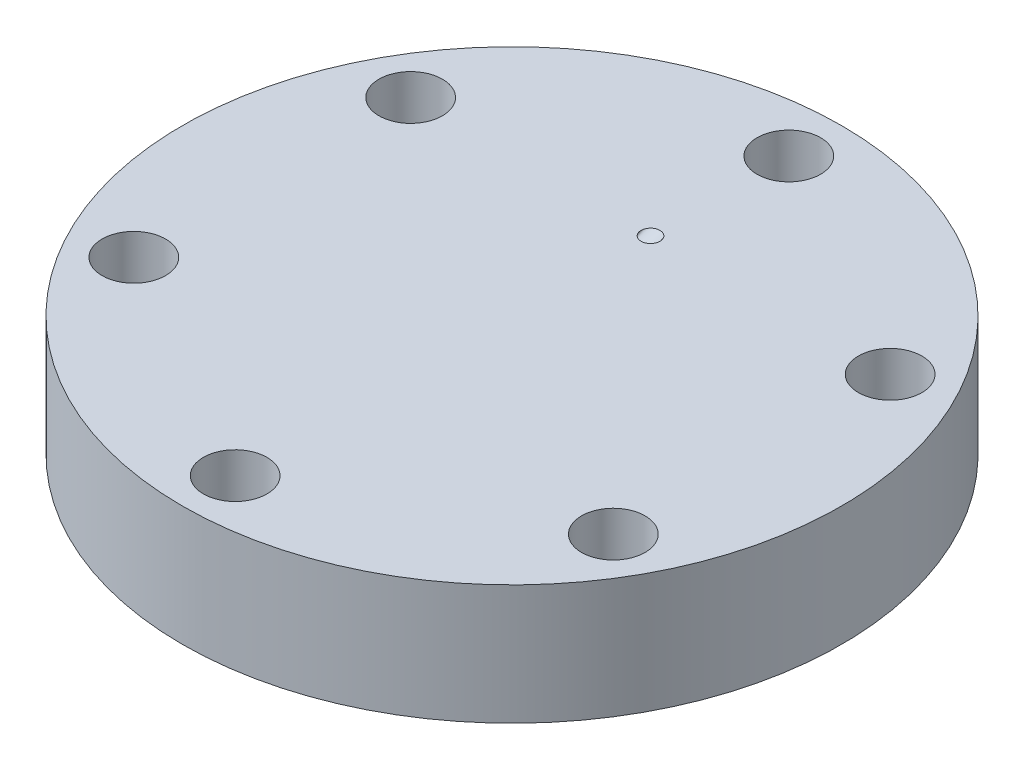
from build123d import *

# Parameters (mm, degrees)
SKETCH1_R          = 34.925
EXTRUDE1_DEPTH     = 12.7
SKETCH3_R          = 3.3655
CUT_EXTRUDE2_DEPTH = 12.7
CIRPATTERN1_COUNT  = 6


with BuildPart() as part:
    # Sketch1 → Extrude1 (new body)
    with BuildSketch(Plane(origin=(0, 0, 0), x_dir=(1, 0, 0), z_dir=(0, 1, 0))):
        with Locations(Location((0, 0, 0), (0, 0, 270))):
            Circle(SKETCH1_R)
    extrude(amount=EXTRUDE1_DEPTH)

    # Sketch3 → Cut-Extrude2 (cut)
    with BuildSketch(Plane(origin=(0, 0, 0), x_dir=(1, 0, 0), z_dir=(0, 1, 0))):
        with Locations(Location((0, 29.337, 0), (0, 0, 270))):
            Circle(SKETCH3_R)
    cut_extrude2 = extrude(amount=CUT_EXTRUDE2_DEPTH, mode=Mode.SUBTRACT)

    # CirPattern1: Cut-Extrude2 ×6 about axis
    cirpattern1_axis = Axis((0, 0, 0), (0, 1, 0))
    for i in range(1, CIRPATTERN1_COUNT):
        add(cut_extrude2.rotate(cirpattern1_axis, i * 360 / CIRPATTERN1_COUNT), mode=Mode.SUBTRACT)

    # Cut-Loft1: read off the stored shape, not the designer's step
    # Cut-Loft1: loft between two sections, ruled curve by curve
    cut_loft1_from = [
        Edge.make_bspline([(0.087851197, 12.7, -13.685066391), (0.004840062, 12.7, -13.677745458), (-0.089952358, 12.7, -13.679558172), (-0.299208166, 12.7, -13.721068628), (-0.414116861, 12.7, -13.7612625), (-0.640681556, 12.7, -13.901902289), (-0.751907991, 12.7, -14.003527296), (-0.92329137, 12.7, -14.266303666), (-0.981491743, 12.7, -14.427326535), (-1.010775475, 12.7, -14.759371072), (-0.981656178, 12.7, -14.928094853), (-0.85891014, 12.7, -15.216811138), (-0.767187279, 12.7, -15.336334686), (-0.568734967, 12.7, -15.514457652), (-0.462634818, 12.7, -15.574142777), (-0.2638743, 12.7, -15.651637083), (-0.170862331, 12.7, -15.670012676), (-0.004840062, 12.7, -15.684654542), (0.089952358, 12.7, -15.682841828), (0.299208166, 12.7, -15.641331372), (0.414116861, 12.7, -15.6011375), (0.640681556, 12.7, -15.460497711), (0.751907991, 12.7, -15.358872704), (0.92329137, 12.7, -15.096096334), (0.981491743, 12.7, -14.935073465), (1.010775475, 12.7, -14.603028928), (0.981656178, 12.7, -14.434305147), (0.85891014, 12.7, -14.145588862), (0.767187279, 12.7, -14.026065314), (0.568734967, 12.7, -13.847942348), (0.462634818, 12.7, -13.788257223), (0.2638743, 12.7, -13.710762917), (0.170862331, 12.7, -13.692387324), (0.087851197, 12.7, -13.685066391)], [0, 0, 0, 0, 0.0625, 0.0625, 0.125, 0.125, 0.1875, 0.1875, 0.25, 0.25, 0.3125, 0.3125, 0.375, 0.375, 0.4375, 0.4375, 0.5, 0.5, 0.5625, 0.5625, 0.625, 0.625, 0.6875, 0.6875, 0.75, 0.75, 0.8125, 0.8125, 0.875, 0.875, 0.9375, 0.9375, 1, 1, 1, 1], 3),
    ]
    cut_loft1_to = [
        Edge.make_bspline([(0, 0, 15.6812), (-0.083333333, 0, 15.6812), (-0.1776, 0, 15.671066667), (-0.3824, 0, 15.611333333), (-0.493333333, 0, 15.5612), (-0.706666667, 0, 15.4012), (-0.808535179, 0, 15.29019654), (-0.956170704, 0, 15.013379931), (-1, 0, 14.847866667), (-1, 0, 14.514533333), (-0.956170704, 0, 14.349020069), (-0.808535179, 0, 14.07220346), (-0.706666667, 0, 13.9612), (-0.493333333, 0, 13.8012), (-0.3824, 0, 13.751066667), (-0.1776, 0, 13.691333333), (-0.083333333, 0, 13.6812), (0.083333333, 0, 13.6812), (0.1776, 0, 13.691333333), (0.3824, 0, 13.751066667), (0.493333333, 0, 13.8012), (0.706666667, 0, 13.9612), (0.808535179, 0, 14.07220346), (0.956170704, 0, 14.349020069), (1, 0, 14.514533333), (1, 0, 14.847866667), (0.956170704, 0, 15.013379931), (0.808535179, 0, 15.29019654), (0.706666667, 0, 15.4012), (0.493333333, 0, 15.5612), (0.3824, 0, 15.611333333), (0.1776, 0, 15.671066667), (0.083333333, 0, 15.6812), (0, 0, 15.6812)], [0, 0, 0, 0, 0.0625, 0.0625, 0.125, 0.125, 0.1875, 0.1875, 0.25, 0.25, 0.3125, 0.3125, 0.375, 0.375, 0.4375, 0.4375, 0.5, 0.5, 0.5625, 0.5625, 0.625, 0.625, 0.6875, 0.6875, 0.75, 0.75, 0.8125, 0.8125, 0.875, 0.875, 0.9375, 0.9375, 1, 1, 1, 1], 3),
    ]
    cut_loft1 = Solid(Shell([*[Face.make_surface_from_curves(cut_loft1_from[k], cut_loft1_to[k]) for k in range(1)], Face(Wire(cut_loft1_from)), Face(Wire(cut_loft1_to))]))
    add(cut_loft1, mode=Mode.SUBTRACT)


solid = part.part
